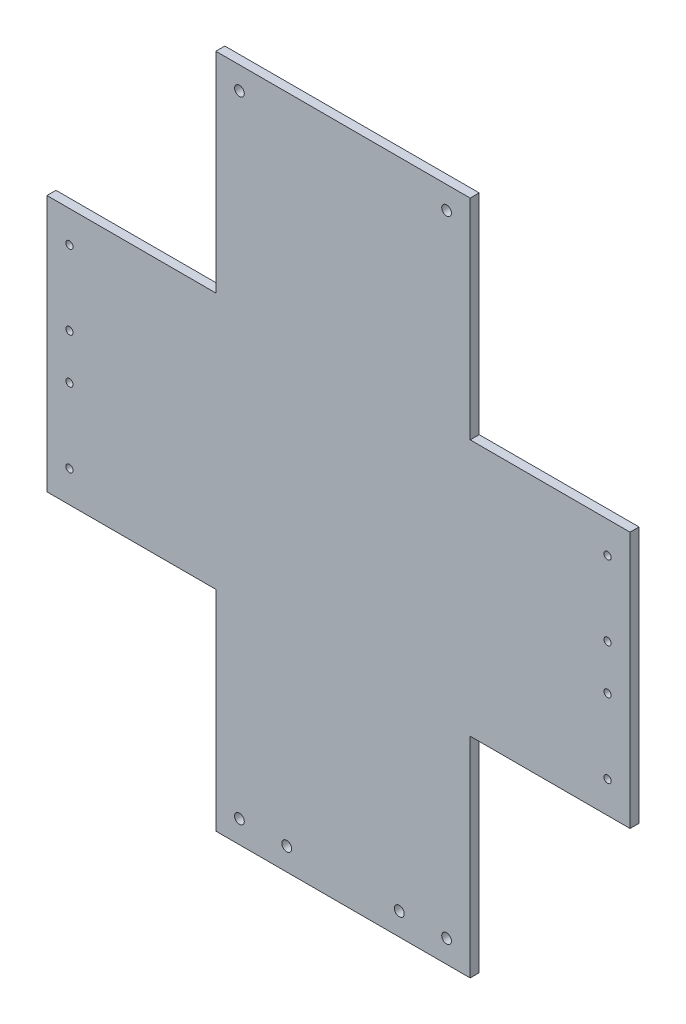
from build123d import *

# Parameters (mm, degrees)
SKETCH_281X300_25_R   = 2.15
SKETCH_281X300_25_R_2 = 2.2
SKETCH_281X300_25_R_3 = 1.6
F_4MM_DEPTH           = 4


with BuildPart() as part:
    # 底板轮廓_281x300_安装孔外移25 → 凸台拉伸_4mm (new body)
    with BuildSketch(Plane.XY):
        Polygon((-55.5, 150), (-55.5, 57), (-130.5, 57), (-130.5, -57), (-55.5, -57), (-55.5, -150), (57.5, -150), (57.5, -57), (128.5, -57), (128.5, 57), (57.5, 57), (57.5, 150), align=None)
        with Locations((-45, 140)):
            Circle(SKETCH_281X300_25_R, mode=Mode.SUBTRACT)
        with Locations((26, -140)):
            Circle(SKETCH_281X300_25_R_2, mode=Mode.SUBTRACT)
        with Locations((-24, -140)):
            Circle(SKETCH_281X300_25_R_2, mode=Mode.SUBTRACT)
        with Locations((118.5, 10)):
            Circle(SKETCH_281X300_25_R_3, mode=Mode.SUBTRACT)
        with Locations((118.5, -10)):
            Circle(SKETCH_281X300_25_R_3, mode=Mode.SUBTRACT)
        with Locations((-120.5, 10)):
            Circle(SKETCH_281X300_25_R_3, mode=Mode.SUBTRACT)
        with Locations((-120.5, -10)):
            Circle(SKETCH_281X300_25_R_3, mode=Mode.SUBTRACT)
        with Locations((118.5, 43)):
            Circle(SKETCH_281X300_25_R_3, mode=Mode.SUBTRACT)
        with Locations((118.5, -43)):
            Circle(SKETCH_281X300_25_R_3, mode=Mode.SUBTRACT)
        with Locations((-120.5, 43)):
            Circle(SKETCH_281X300_25_R_3, mode=Mode.SUBTRACT)
        with Locations((-120.5, -43)):
            Circle(SKETCH_281X300_25_R_3, mode=Mode.SUBTRACT)
        with Locations((47, 140)):
            Circle(SKETCH_281X300_25_R, mode=Mode.SUBTRACT)
        with Locations((-45, -140)):
            Circle(SKETCH_281X300_25_R, mode=Mode.SUBTRACT)
        with Locations((47, -140)):
            Circle(SKETCH_281X300_25_R, mode=Mode.SUBTRACT)
    extrude(amount=F_4MM_DEPTH)


solid = part.part
